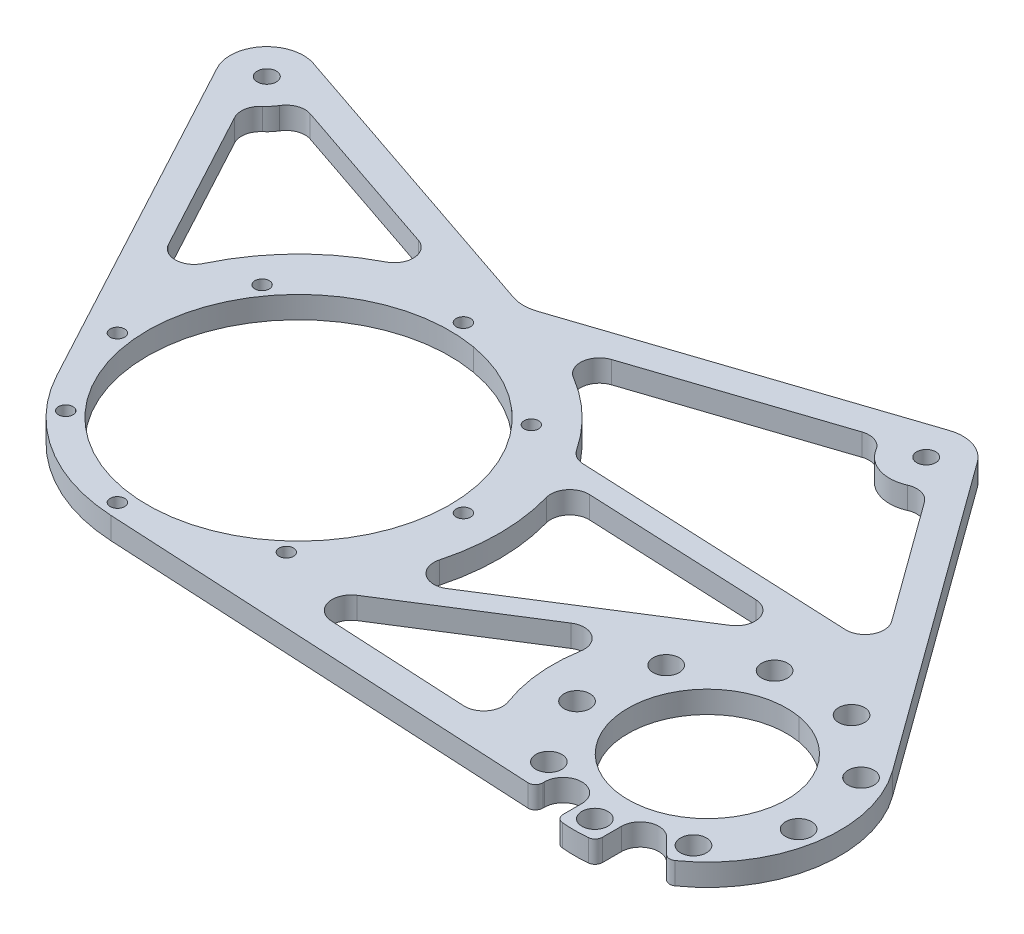
from build123d import *

# Parameters (mm, degrees)
SKETCH2_R           = 4.5
SKETCH2_R_2         = 27.4955
SKETCH2_R_3         = 2.5
SKETCH2_R_4         = 52.3875
SKETCH2_R_5         = 3.3
BOSS_EXTRUDE1_DEPTH = 7.62
CUT_EXTRUDE1_DEPTH  = 809.692322627
FILLET2_R           = 12.7
CUT_EXTRUDE2_DEPTH  = 809.692322627
FILLET3_R           = 6.604


with BuildPart() as part:
    # Sketch2 → Boss-Extrude1 (new body)
    with BuildSketch(Plane(origin=(0, -92.400800062, 0), x_dir=(1, 0, 0), z_dir=(0, 1, 0))):
        with BuildLine():
            ThreePointArc((-517.357294488, -163.648012211), (-510.857294488, -157.148012211), (-504.357294488, -163.648012211))
            Line((-504.357294488, -163.648012211), (-504.357294488, -170.220745001))
            ThreePointArc((-504.357294488, -170.220745001), (-503.700129194, -171.925600851), (-502.068685458, -172.748273949))
            ThreePointArc((-502.068685458, -172.748273949), (-497.518508898, -172.974), (-492.968332338, -172.748273949))
            ThreePointArc((-492.968332338, -172.748273949), (-491.336888602, -171.925600851), (-490.679723308, -170.220745001))
            Line((-490.679723308, -170.220745001), (-490.679723308, -163.648012211))
            ThreePointArc((-490.679723308, -163.648012211), (-486.667165619, -157.642795249), (-479.583529231, -159.051818133))
            Line((-479.583529231, -159.051818133), (-474.318645613, -164.316701751))
            ThreePointArc((-474.318645613, -164.316701751), (-472.741009017, -165.051242365), (-471.060845002, -164.597881552))
            ThreePointArc((-471.060845002, -164.597881552), (-452.166637143, -134.537665705), (-460.321389629, -99.981802538))
            Line((-460.321389629, -99.981802538), (-538.364552688, 7.463590459))
            ThreePointArc((-538.364552688, 7.463590459), (-542.8736146, 11.315423077), (-548.64, 12.7))
            Line((-548.64, 12.7), (-777.24, 12.7))
            ThreePointArc((-777.24, 12.7), (-788.140044938, 6.517593141), (-788.427725689, -6.010390496))
            Line((-788.427725689, -6.010390496), (-723.830162734, -126.252131037))
            ThreePointArc((-723.830162734, -126.252131037), (-702.441096866, -149.240696459), (-672.52489318, -158.779408942))
            Line((-672.52489318, -158.779408942), (-519.897294488, -166.765022653))
            ThreePointArc((-519.897294488, -166.765022653), (-518.101243263, -166.021073877), (-517.357294488, -164.225022653))
            Line((-517.357294488, -164.225022653), (-517.357294488, -163.648012211))
        make_face()
        with Locations((-497.518508898, -166)):
            Circle(SKETCH2_R, mode=Mode.SUBTRACT)
        with Locations((-522.587225676, -156.875733282)):
            Circle(SKETCH2_R, mode=Mode.SUBTRACT)
        with Locations((-472.44979212, -156.875733282)):
            Circle(SKETCH2_R, mode=Mode.SUBTRACT)
        with Locations((-535.926011265, -133.772278929)):
            Circle(SKETCH2_R, mode=Mode.SUBTRACT)
        with Locations((-497.518508898, -127)):
            Circle(SKETCH2_R_2, mode=Mode.SUBTRACT)
        with Locations((-459.111006531, -133.772278929)):
            Circle(SKETCH2_R, mode=Mode.SUBTRACT)
        with Locations((-531.293499646, -107.5)):
            Circle(SKETCH2_R, mode=Mode.SUBTRACT)
        with Locations((-463.74351815, -107.5)):
            Circle(SKETCH2_R, mode=Mode.SUBTRACT)
        with Locations((-510.857294488, -90.351987789)):
            Circle(SKETCH2_R, mode=Mode.SUBTRACT)
        with Locations((-484.179723308, -90.351987789)):
            Circle(SKETCH2_R, mode=Mode.SUBTRACT)
        with Locations((-669.29, -39.801477371)):
            Circle(SKETCH2_R_3, mode=Mode.SUBTRACT)
        with Locations((-626.819273224, -58.710663218)):
            Circle(SKETCH2_R_3, mode=Mode.SUBTRACT)
        with Locations((-711.760726776, -135.192291524)):
            Circle(SKETCH2_R_3, mode=Mode.SUBTRACT)
        with Locations((-675.263801676, -153.788403691)):
            Circle(SKETCH2_R_3, mode=Mode.SUBTRACT)
        with Locations((-631.049185847, -139.422204147)):
            Circle(SKETCH2_R_3, mode=Mode.SUBTRACT)
        with Locations((-726.12692632, -102.925279047)):
            Circle(SKETCH2_R_3, mode=Mode.SUBTRACT)
        with Locations((-669.29, -96.951477371)):
            Circle(SKETCH2_R_4, mode=Mode.SUBTRACT)
        with Locations((-612.14, -96.951477371)):
            Circle(SKETCH2_R_3, mode=Mode.SUBTRACT)
        with Locations((-715.525321229, -63.359550203)):
            Circle(SKETCH2_R_3, mode=Mode.SUBTRACT)
        with Locations((-777.24, 0)):
            Circle(SKETCH2_R_5, mode=Mode.SUBTRACT)
        with Locations((-548.64, 0)):
            Circle(SKETCH2_R_5, mode=Mode.SUBTRACT)
    extrude(amount=BOSS_EXTRUDE1_DEPTH)

    # Sketch3 → Cut-Extrude1 (cut, through all)
    with BuildSketch(Plane.XZ.offset(92.400800062)):
        with BuildLine():
            Line((-777.24, -12.7), (-548.64, -12.7))
            ThreePointArc((-548.64, -12.7), (-550.668160815, -12.537007765), (-552.64426266, -12.052214757))
            Line((-552.64426266, -12.052214757), (-664.03608497, 24.956926191))
            Line((-664.03608497, 24.956926191), (-773.163537082, -12.027986119))
            ThreePointArc((-773.163537082, -12.027986119), (-775.174258452, -12.530870355), (-777.24, -12.7))
        make_face()
    extrude(amount=-CUT_EXTRUDE1_DEPTH, mode=Mode.SUBTRACT)

    # Fillet2
    fillet2_edges = [part.edges().sort_by_distance(p)[0] for p in [
        (-664.03608497, -88.590800062, 24.956926191),
    ]]
    fillet(fillet2_edges, radius=FILLET2_R)

    # Sketch4 → Cut-Extrude2 (cut, through all)
    with BuildSketch(Plane.XZ.offset(92.400800062)):
        with BuildLine():
            Line((-736.856981399, 80.535887803), (-773.58858919, 12.163765827))
            ThreePointArc((-773.58858919, 12.163765827), (-767.545245115, 8.203763023), (-764.639735967, 1.588504418))
            Line((-764.639735967, 1.588504418), (-683.866014064, 28.963916963))
            ThreePointArc((-683.866014064, 28.963916963), (-717.785205639, 47.121932056), (-736.856981399, 80.535887803))
        make_face()
        with BuildLine():
            ThreePointArc((-561.249563102, 1.512917174), (-552.52533235, 12.091079047), (-539.272115228, 8.575123025))
            Line((-539.272115228, 8.575123025), (-497.282288096, 66.384331434))
            Line((-497.282288096, 66.384331434), (-609.583655516, 61.315526638))
            ThreePointArc((-609.583655516, 61.315526638), (-626.274159009, 42.321760366), (-648.652955158, 30.552072732))
            Line((-648.652955158, 30.552072732), (-561.249563102, 1.512917174))
        make_face()
        with BuildLine():
            ThreePointArc((-544.566763105, 101.333317081), (-551.089412759, 128.573243633), (-542.979445806, 155.383446786))
            Line((-542.979445806, 155.383446786), (-623.380719442, 151.176779587))
            Line((-623.380719442, 151.176779587), (-544.566763105, 101.333317081))
        make_face()
        with BuildLine():
            Line((-514.400222835, 73.239458777), (-610.432001109, 133.971803177))
            ThreePointArc((-610.432001109, 133.971803177), (-599.952234674, 102.151751969), (-605.568508267, 69.124511177))
            Line((-605.568508267, 69.124511177), (-514.400222835, 73.239458777))
        make_face()
    extrude(amount=-CUT_EXTRUDE2_DEPTH, mode=Mode.SUBTRACT)

    # Fillet3
    fillet3_edges = [part.edges().sort_by_distance(p)[0] for p in [
        (-544.566763105, -88.590800062, 101.333317081),
        (-542.979445806, -88.590800062, 155.383446786),
        (-623.380719442, -88.590800062, 151.176779587),
        (-514.400222835, -88.590800062, 73.239458777),
        (-605.568508267, -88.590800062, 69.124511177),
        (-610.432001109, -88.590800062, 133.971803177),
        (-497.282288096, -88.590800062, 66.384331434),
        (-609.583655516, -88.590800062, 61.315526638),
        (-648.652955158, -88.590800062, 30.552072732),
        (-561.249563102, -88.590800062, 1.512917174),
        (-539.272115228, -88.590800062, 8.575123025),
        (-764.639735967, -88.590800062, 1.588504418),
        (-773.58858919, -88.590800062, 12.163765827),
        (-683.866014064, -88.590800062, 28.963916963),
        (-736.856981399, -88.590800062, 80.535887803),
    ]]
    fillet(fillet3_edges, radius=FILLET3_R)


solid = part.part
